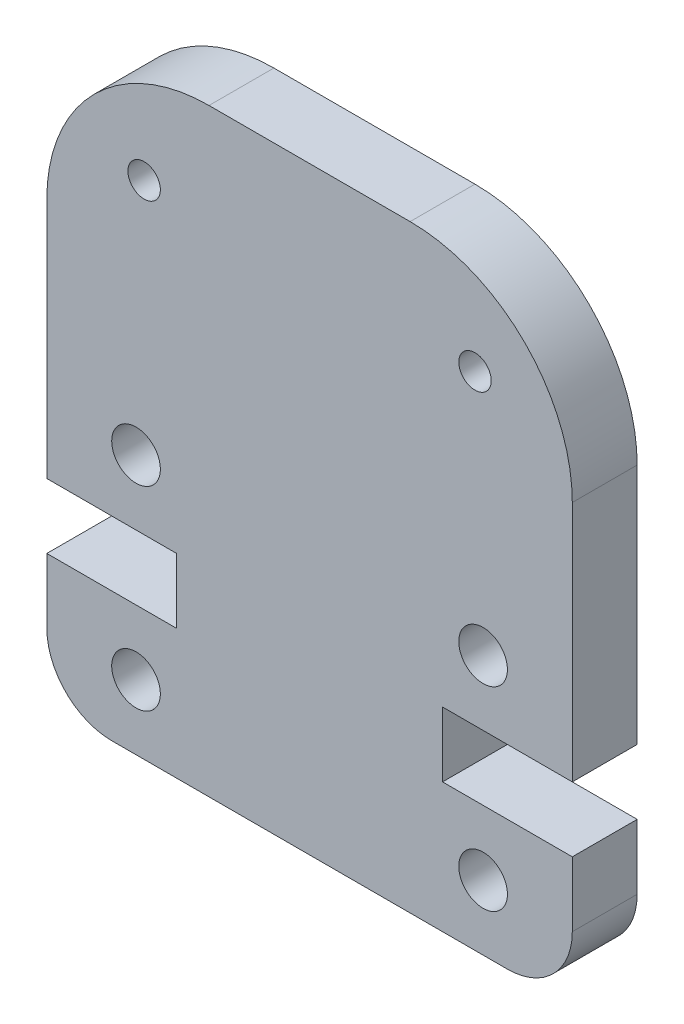
from build123d import *

# Parameters (mm, degrees)
SKETCH2_R           = 0.5
SKETCH2_R_2         = 0.75
BOSS_EXTRUDE1_DEPTH = 2


with BuildPart() as part:
    # Sketch2 → Boss-Extrude1 (new body)
    with BuildSketch(Plane.XY):
        with BuildLine():
            Line((0, 13.46), (0, 6))
            Line((0, 6), (4, 6))
            Line((4, 6), (4, 4))
            Line((4, 4), (0, 4))
            Line((0, 4), (0, 2))
            ThreePointArc((0, 2), (0.585786438, 0.585786438), (2, 0))
            Line((2, 0), (14.2, 0))
            ThreePointArc((14.2, 0), (15.614213562, 0.585786438), (16.2, 2))
            Line((16.2, 2), (16.2, 4))
            Line((16.2, 4), (12.2, 4))
            Line((12.2, 4), (12.2, 6))
            Line((12.2, 6), (16.2, 6))
            Line((16.2, 6), (16.2, 13.46))
            ThreePointArc((16.2, 13.46), (14.735533906, 16.995533906), (11.2, 18.46))
            Line((11.2, 18.46), (5, 18.46))
            ThreePointArc((5, 18.46), (1.464466094, 16.995533906), (0, 13.46))
        make_face()
        with Locations((3, 15.46)):
            Circle(SKETCH2_R, mode=Mode.SUBTRACT)
        with Locations((13.2, 15.46)):
            Circle(SKETCH2_R, mode=Mode.SUBTRACT)
        with Locations((13.45, 2)):
            Circle(SKETCH2_R_2, mode=Mode.SUBTRACT)
        with Locations((2.75, 2)):
            Circle(SKETCH2_R_2, mode=Mode.SUBTRACT)
        with Locations((2.75, 8)):
            Circle(SKETCH2_R_2, mode=Mode.SUBTRACT)
        with Locations((13.45, 8)):
            Circle(SKETCH2_R_2, mode=Mode.SUBTRACT)
    extrude(amount=BOSS_EXTRUDE1_DEPTH)


solid = part.part
